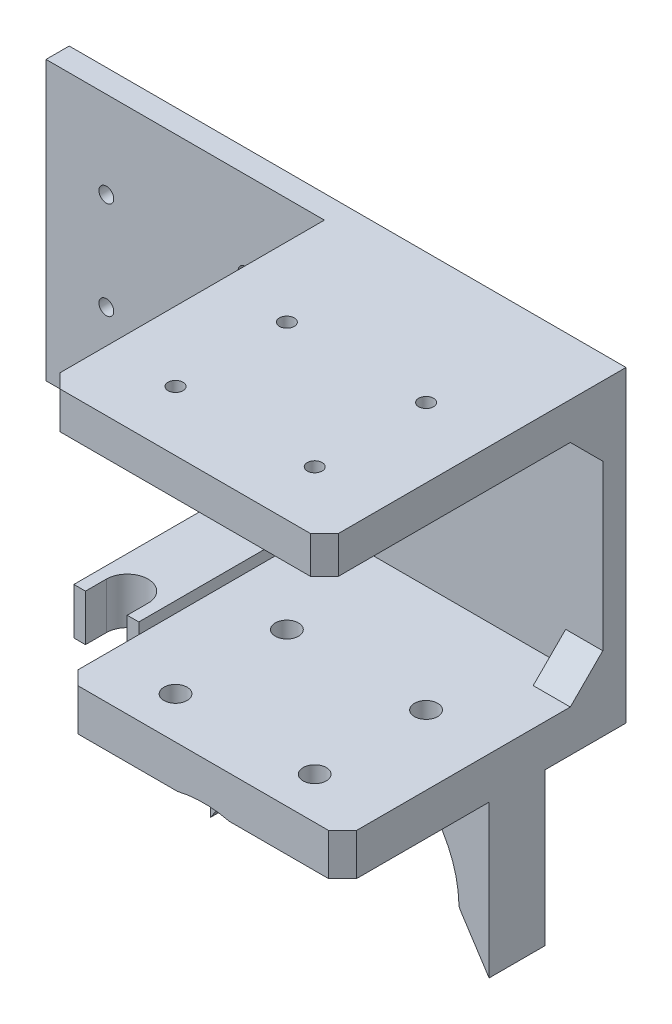
from build123d import *
from build123d.topology import SkipClean

# Parameters (mm, degrees)
SKETCH_1_W               = 120
SKETCH_1_H               = 60
EXTRUDE_1_DEPTH          = 5
SKETCH_3_W               = 60
SKETCH_3_H               = 8
EXTRUDE_3_DEPTH          = 60
SKETCH_4_W               = 61.088110118
SKETCH_4_H               = 9
EXTRUDE_4_DEPTH          = 60
SKETCH_6_R               = 23.5
CUT_EXTRUDE_1_DEPTH      = 134.603892159
EXTRUDE_5_DEPTH          = 50
SKETCH_8_W               = 20.5
SKETCH_8_H               = 32.830920687
SKETCH_8_W_2             = 17.5
CUT_EXTRUDE_2_DEPTH      = 60
EXTRUDE_6_DEPTH          = 10
SKETCH_11_R              = 1.6
CUT_EXTRUDE_3_DEPTH      = 141.605734288
SKETCH_12_R              = 1.6
CUT_EXTRUDE_4_DEPTH      = 134.603892159
RIB_1_REACH              = 160.193
SKETCH_13_WALL_W         = 328.285335328
SKETCH_13_WALL_H         = 8
MIRROR_2_COPY_1_REACH    = 160.193
MIRROR_2_COPY_1_SKETCH_W = 328.285335328
MIRROR_2_COPY_1_SKETCH_H = 8
SKETCH_15_W              = 5
SKETCH_15_H              = 6.382962656
EXTRUDE_7_DEPTH          = 10
CHAMFER_2_SIZE           = 2
CHAMFER_3_SIZE           = 3
SKETCH_16_R              = 2.5
CUT_EXTRUDE_5_DEPTH      = 122.419950598
SKETCH_18_R              = 3.75
CUT_EXTRUDE_7_DEPTH      = 2


with BuildPart() as part:
    # 草图1 → 凸台-拉伸1 (new body)
    with BuildSketch(Plane.XY):
        with Locations((-25, 50)):
            Rectangle(SKETCH_1_W, SKETCH_1_H)
    extrude(amount=EXTRUDE_1_DEPTH)

    # 草图3 → 凸台-拉伸3 (add)
    with BuildSketch(Plane.XY.offset(5)):
        with Locations((5, 76)):
            Rectangle(SKETCH_3_W, SKETCH_3_H)
    extrude(amount=EXTRUDE_3_DEPTH)

    # 草图4 → 凸台-拉伸4 (add)
    with BuildSketch(Plane(origin=(35, 0, 0), x_dir=(0, 0, -1), z_dir=(1, 0, 0))):
        with Locations((-30.544055059, 18.117037344)):
            Rectangle(SKETCH_4_W, SKETCH_4_H)
    extrude(amount=-EXTRUDE_4_DEPTH)

    # 草图6 → 切除-拉伸1 (cut, through all)
    with BuildSketch(Plane(origin=(0, 0, 0), x_dir=(-1, 0, 0), z_dir=(0, 0, -1))):
        with Locations((-5, -9.213883343)):
            Circle(SKETCH_6_R)
    extrude(amount=-CUT_EXTRUDE_1_DEPTH, mode=Mode.SUBTRACT)

    # 草图7 → 凸台-拉伸5 (add)
    with SkipClean():  # the faces are left unmerged after this step: merging them gives an invalid solid
        with BuildSketch(Plane(origin=(0, 0, 0), x_dir=(-1, 0, 0), z_dir=(0, 0, -1))):
            with BuildLine():
                Line((-10.567680001, 13.617037344), (-35, 13.617037344))
                Line((-35, 13.617037344), (-35, -19.213883343))
                Line((-35, -19.213883343), (-28.815961295, -9.699977643))
                ThreePointArc((-28.815961295, -9.699977643), (-28.582193015, -9.201097813), (-28.493409427, -8.657364267))
                ThreePointArc((-28.493409427, -8.657364267), (-23.307757139, 5.51961687), (-10.567680001, 13.617037344))
            make_face()
            with BuildLine():
                Line((25, 13.617037344), (0.567680001, 13.617037344))
                ThreePointArc((0.567680001, 13.617037344), (13.307757139, 5.51961687), (18.493409427, -8.657364267))
                ThreePointArc((18.493409427, -8.657364267), (18.582193015, -9.201097813), (18.815961295, -9.699977643))
                Line((18.815961295, -9.699977643), (25, -19.213883343))
                Line((25, -19.213883343), (25, 13.617037344))
            make_face()
        extrude(amount=-EXTRUDE_5_DEPTH)

    # 草图8 → 切除-拉伸2 (cut)
    with SkipClean():  # the faces are left unmerged after this step: merging them gives an invalid solid
        with BuildSketch(Plane(origin=(35, 0, 0), x_dir=(0, 0, -1), z_dir=(1, 0, 0))):
            with Locations((-39.75, -2.798423)):
                Rectangle(SKETCH_8_W, SKETCH_8_H)
            with Locations((-8.75, -2.798423)):
                Rectangle(SKETCH_8_W_2, SKETCH_8_H)
        extrude(amount=-CUT_EXTRUDE_2_DEPTH, mode=Mode.SUBTRACT)

    # 草图9 → 凸台-拉伸6 (add)
    with SkipClean():  # the faces are left unmerged after this step: merging them gives an invalid solid
        with BuildSketch(Plane.XZ.offset(-20)):
            with BuildLine():
                Line((-32.5, 0), (-41.5, 0))
                Line((-41.5, 0), (-44, 0))
                Line((-44, 0), (-44, 40))
                Line((-44, 40), (-41.5, 40))
                Line((-41.5, 40), (-41.5, 35.5))
                ThreePointArc((-41.5, 35.5), (-37, 31), (-32.5, 35.5))
                Line((-32.5, 35.5), (-32.5, 40))
                Line((-32.5, 40), (-30, 40))
                Line((-30, 40), (-30, 0))
                Line((-30, 0), (-32.5, 0))
            make_face()
        extrude(amount=EXTRUDE_6_DEPTH)

    # 草图11 → 切除-拉伸3 (cut, through all)
    with SkipClean():  # the faces are left unmerged after this step: merging them gives an invalid solid
        with BuildSketch(Plane(origin=(0, 72, 0), x_dir=(-1, 0, 0), z_dir=(0, -1, 0))):
            with Locations((-20, -52.088110118)):
                Circle(SKETCH_11_R)
            with Locations((10, -28.088110118)):
                Circle(SKETCH_11_R)
            with Locations((-20, -28.088110118)):
                Circle(SKETCH_11_R)
            with Locations((10, -52.088110118)):
                Circle(SKETCH_11_R)
        extrude(amount=-CUT_EXTRUDE_3_DEPTH, mode=Mode.SUBTRACT)

    # 草图12 → 切除-拉伸4 (cut, through all)
    with SkipClean():  # the faces are left unmerged after this step: merging them gives an invalid solid
        with BuildSketch(Plane(origin=(0, 0, 0), x_dir=(-1, 0, 0), z_dir=(0, 0, -1))):
            with Locations((42, 40.25)):
                Circle(SKETCH_12_R)
            with Locations((42, 61.25)):
                Circle(SKETCH_12_R)
            with Locations((72, 40.25)):
                Circle(SKETCH_12_R)
            with Locations((72, 61.25)):
                Circle(SKETCH_12_R)
        extrude(amount=-CUT_EXTRUDE_4_DEPTH, mode=Mode.SUBTRACT)

    # 草图13 wall → 筋1 (add, up to next)
    with BuildSketch(Plane(origin=(35, 68.5, 8.5), x_dir=(0, 0.707106781187, 0.707106781187), z_dir=(0, -0.707106781187, 0.707106781187)), mode=Mode.PRIVATE) as rib_1_sk1:
        with Locations((0, 4)):
            Rectangle(SKETCH_13_WALL_W, SKETCH_13_WALL_H)
    rib_1_tool1 = extrude(rib_1_sk1.sketch, amount=-RIB_1_REACH, mode=Mode.PRIVATE) - part.part
    rib_1 = rib_1_tool1.solids().sort_by_distance((35, 68.5, 8.5))[0]
    add(rib_1)

    # 镜向1: 筋1 across plane
    with SkipClean():  # the faces are left unmerged after this step: merging them gives an invalid solid
        add(rib_1.mirror(Plane(origin=(5, 0, 0), x_dir=(0, 0, 1), z_dir=(1, 0, 0))))

    # 镜向2: 筋1 across plane
    with SkipClean():  # the faces are left unmerged after this step: merging them gives an invalid solid
        add(rib_1.mirror(Plane(origin=(0, 47.308518672, 0), x_dir=(0, 0, 1), z_dir=(0, -1, 0))))

    # 镜向2 copy 1 sketch → 镜向2 copy 1 (add, up to next)
    with BuildSketch(Plane(origin=(-25, 26.117037344, 8.5), x_dir=(0, -0.7071067811870001, 0.7071067811869999), z_dir=(0, 0.7071067811869999, 0.7071067811870001)), mode=Mode.PRIVATE) as mirror_2_copy_1_sk1:
        with Locations((0, 4)):
            Rectangle(MIRROR_2_COPY_1_SKETCH_W, MIRROR_2_COPY_1_SKETCH_H)
    mirror_2_copy_1_tool1 = extrude(mirror_2_copy_1_sk1.sketch, amount=-MIRROR_2_COPY_1_REACH, mode=Mode.PRIVATE) - part.part
    add(mirror_2_copy_1_tool1.solids().sort_by_distance((-25, 26.117037344, 8.5))[0])

    # 草图15 → 凸台-拉伸7 (add)
    with SkipClean():  # the faces are left unmerged after this step: merging them gives an invalid solid
        with BuildSketch(Plane(origin=(0, 0, 0), x_dir=(-1, 0, 0), z_dir=(0, 0, -1))):
            with Locations((27.5, 16.808518672)):
                Rectangle(SKETCH_15_W, SKETCH_15_H)
            with Locations((46.5, 16.808518672)):
                Rectangle(SKETCH_15_W, SKETCH_15_H)
        extrude(amount=-EXTRUDE_7_DEPTH)

    # 倒角2
    chamfer_2_edges = [part.edges().sort_by_distance(p)[0] for p in [
        (-49, 16.808518672, 10),
    ]]
    chamfer(chamfer_2_edges, length=CHAMFER_2_SIZE)

    # 倒角3
    chamfer_3_edges = [part.edges().sort_by_distance(p)[0] for p in [
        (-25, 18.117037344, 61.088110118),
        (-25, 76, 65),
        (35, 18.117037344, 61.088110118),
        (35, 76, 65),
    ]]
    chamfer(chamfer_3_edges, length=CHAMFER_3_SIZE)

    # 草图16 → 切除-拉伸5 (cut, through all)
    with SkipClean():  # the faces are left unmerged after this step: merging them gives an invalid solid
        with BuildSketch(Plane(origin=(0, 22.617037344, 0), x_dir=(1, 0, 0), z_dir=(0, 1, 0))):
            with Locations((20, -52.088110118)):
                Circle(SKETCH_16_R)
            with Locations((-10, -52.088110118)):
                Circle(SKETCH_16_R)
            with Locations((-10, -28.088110118)):
                Circle(SKETCH_16_R)
            with Locations((20, -28.088110118)):
                Circle(SKETCH_16_R)
        extrude(amount=-CUT_EXTRUDE_5_DEPTH, mode=Mode.SUBTRACT)

    # 草图18 → 切除-拉伸7 (cut)
    with SkipClean():  # the faces are left unmerged after this step: merging them gives an invalid solid
        with BuildSketch(Plane(origin=(0, 0, 0), x_dir=(-1, 0, 0), z_dir=(0, 0, -1))):
            with Locations((75, 75)):
                Circle(SKETCH_18_R)
            with Locations((25, 75)):
                Circle(SKETCH_18_R)
            with Locations((-25, 75)):
                Circle(SKETCH_18_R)
            with Locations((-25, 25)):
                Circle(SKETCH_18_R)
            with Locations((25, 25)):
                Circle(SKETCH_18_R)
            with Locations((75, 25)):
                Circle(SKETCH_18_R)
        extrude(amount=-CUT_EXTRUDE_7_DEPTH, mode=Mode.SUBTRACT)


solid = part.part
